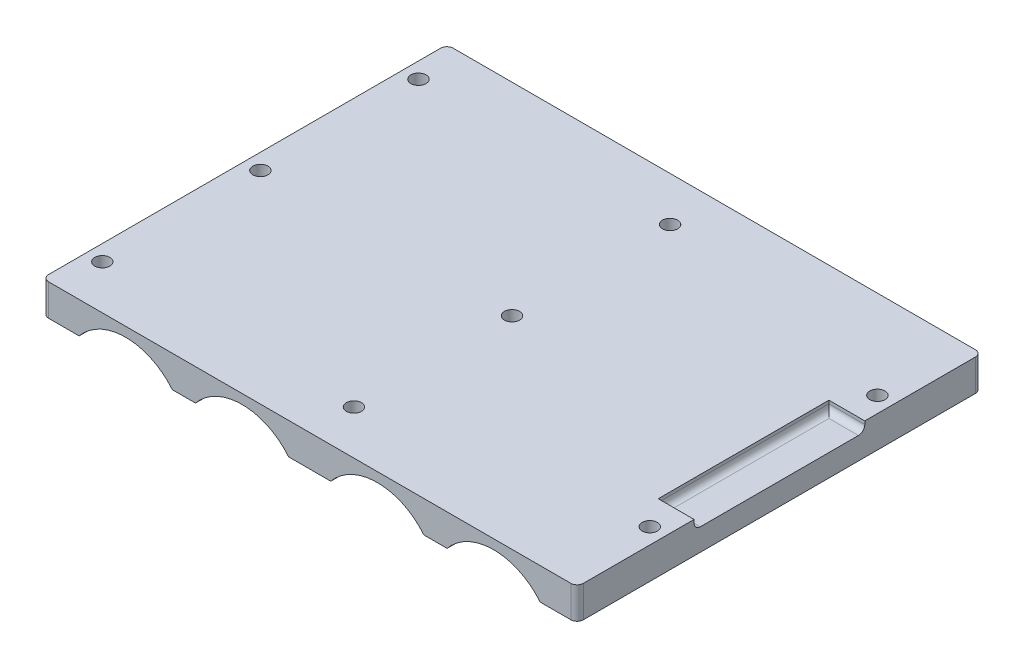
from build123d import *

# Parameters (mm, degrees)
BOSS_EXTRUDE1_DEPTH  = 32
M2_CLEARANCE_HOLE1_D = 2.4
FILLET1_R            = 1
SKETCH9_W            = 5.67
SKETCH9_H            = 27
CUT_EXTRUDE1_DEPTH   = 1.5
FILLET2_R            = 1


with BuildPart() as part:
    # Sketch2 → Boss-Extrude1 (new, symmetric)
    with BuildSketch(Plane.XY):
        with BuildLine():
            Line((3.334540069, -5), (-3.334540069, -5))
            ThreePointArc((-3.334540069, -5), (-10.7, -1.5), (-18.065459931, -5))
            Line((-18.065459931, -5), (-21.734540069, -5))
            ThreePointArc((-21.734540069, -5), (-29.1, -1.5), (-36.465459931, -5))
            Line((-36.465459931, -5), (-42.3, -5))
            Line((-42.3, -5), (-42.3, 0))
            Line((-42.3, 0), (42.3, 0))
            Line((42.3, 0), (42.3, -5))
            Line((42.3, -5), (36.465459931, -5))
            ThreePointArc((36.465459931, -5), (29.1, -1.5), (21.734540069, -5))
            Line((21.734540069, -5), (18.065459931, -5))
            ThreePointArc((18.065459931, -5), (10.7, -1.5), (3.334540069, -5))
        make_face()
    extrude(amount=BOSS_EXTRUDE1_DEPTH, both=True)

    # M2 Clearance Hole1 (through all)
    with Locations(Plane(origin=(0, -5, 0), x_dir=(-1, 0, 0), z_dir=(0, -1, 0))):
        with Locations((0, 25), (0, 0), (0, -25), (39.8, -25), (39.8, 0), (39.8, 25), (-39.8, -18), (-39.8, 18)):
            Hole(M2_CLEARANCE_HOLE1_D / 2)

    # Fillet1
    fillet1_edges = [part.edges().sort_by_distance(p)[0] for p in [
        (-42.3, -2.5, -32),
        (42.3, -2.5, -32),
        (-42.3, -2.5, 32),
        (42.3, -2.5, 32),
    ]]
    fillet(fillet1_edges, radius=FILLET1_R)

    # Sketch9 → Cut-Extrude1 (cut)
    with BuildSketch(Plane(origin=(0, 0, 0), x_dir=(1, 0, 0), z_dir=(0, 1, 0))):
        with Locations((39.465, 0)):
            Rectangle(SKETCH9_W, SKETCH9_H)
    extrude(amount=-CUT_EXTRUDE1_DEPTH, mode=Mode.SUBTRACT)

    # Fillet2
    fillet2_edges = [part.edges().sort_by_distance(p)[0] for p in [
        (39.465, -1.5, -13.5),
        (36.63, -1.5, 0),
        (39.465, -1.5, 13.5),
    ]]
    fillet(fillet2_edges, radius=FILLET2_R)


solid = part.part
